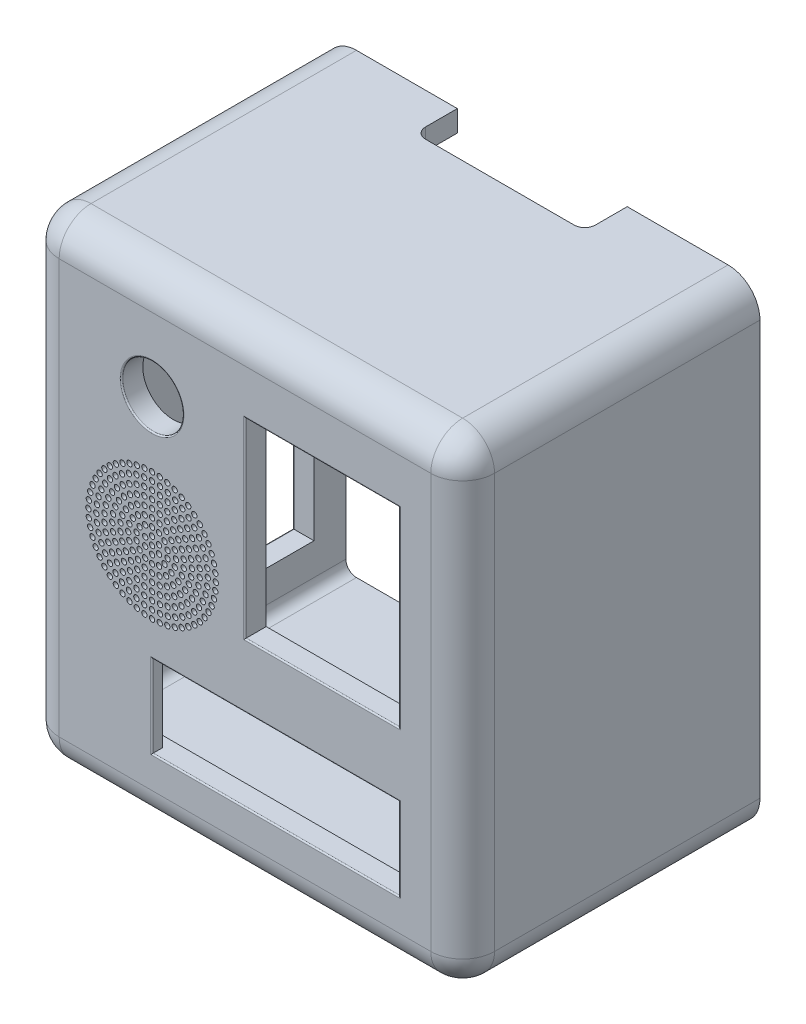
from build123d import *

# Parameters (mm, degrees)
SKETCH1_W               = 130.175
SKETCH1_H               = 142.875
BOSS_EXTRUDE1_DEPTH     = 88.9
FILLET1_R               = 9.525
SHELL2_T                = -6.35
SKETCH3_W               = 33.3375
SKETCH3_H               = 69.05625
CUT_EXTRUDE1_DEPTH      = 6.35
SKETCH4_R               = 9.128125
SKETCH4_R_2             = 19.84375
SKETCH4_W               = 46.0375
SKETCH4_H               = 57.15
SKETCH4_W_2             = 73.81875
SKETCH4_H_2             = 24.60625
CUT_EXTRUDE2_DEPTH      = 6.35
SKETCH5_W               = 50.8
SKETCH5_H               = 12.7
CUT_EXTRUDE3_DEPTH      = 6.35
FILLET2_R               = 3.175
SKETCH6_W               = 3.175
SKETCH6_H               = 24.60625
CUT_EXTRUDE4_DEPTH      = 3.175
SKETCH12_R              = 19.84375
BOSS_EXTRUDE4_DEPTH     = 3.175
FILL_START              = -3.175
FILL_PATTERN1_OUTLINE_R = 0.79375
FILL_PATTERN1_DEPTH     = 3.175
CUT_EXTRUDE5_DEPTH      = 169.342380378
FILLET3_R               = 0.396875
BOSS_EXTRUDE2_DEPTH     = 6.35


# Read off the part's stored shape, not the designer's step: Fill Pattern1
with BuildPart() as part:
    # Sketch1 → Boss-Extrude1 (new body)
    with BuildSketch(Plane.XY):
        Rectangle(SKETCH1_W, SKETCH1_H)
    extrude(amount=-BOSS_EXTRUDE1_DEPTH)

    # Fillet1
    fillet1_edges = [part.edges().sort_by_distance(p)[0] for p in [
        (0, -71.4375, 0),
        (65.0875, 0, 0),
        (0, 71.4375, 0),
        (-65.0875, 0, 0),
        (-65.0875, -71.4375, -44.45),
        (65.0875, -71.4375, -44.45),
        (65.0875, 71.4375, -44.45),
        (-65.0875, 71.4375, -44.45),
    ]]
    fillet(fillet1_edges, radius=FILLET1_R)

    # Shell2
    shell2_openings = [part.faces().sort_by_distance(p)[0] for p in [
        (0, 0, -88.9),
    ]]
    offset(amount=SHELL2_T, openings=shell2_openings, kind=Kind.INTERSECTION)

    # Sketch3 → Cut-Extrude1 (cut)
    with BuildSketch(Plane.ZY.offset(65.0875)):
        with Locations((-62.70625, -17.859375)):
            Rectangle(SKETCH3_W, SKETCH3_H)
    extrude(amount=-CUT_EXTRUDE1_DEPTH, mode=Mode.SUBTRACT)

    # Sketch4 → Cut-Extrude2 (cut)
    with BuildSketch(Plane.XY):
        with Locations((-27.78125, 40.084375)):
            Circle(SKETCH4_R)
        with Locations((-27.78125, 1.5875)):
            Circle(SKETCH4_R_2)
        with Locations((23.01875, 19.84375)):
            Rectangle(SKETCH4_W, SKETCH4_H)
        with Locations((9.128125, -40.084375)):
            Rectangle(SKETCH4_W_2, SKETCH4_H_2)
    extrude(amount=-CUT_EXTRUDE2_DEPTH, mode=Mode.SUBTRACT)

    # Sketch5 → Cut-Extrude3 (cut)
    with BuildSketch(Plane(origin=(0, 71.4375, 0), x_dir=(1, 0, 0), z_dir=(0, 1, 0))):
        with Locations((0, 82.55)):
            Rectangle(SKETCH5_W, SKETCH5_H)
    extrude(amount=-CUT_EXTRUDE3_DEPTH, mode=Mode.SUBTRACT)

    # Fillet2
    fillet2_edges = [part.edges().sort_by_distance(p)[0] for p in [
        (25.4, 68.2625, -76.2),
        (-25.4, 68.2625, -76.2),
    ]]
    fillet(fillet2_edges, radius=FILLET2_R)

    # Sketch6 → Cut-Extrude4 (cut)
    with BuildSketch(Plane(origin=(0, 0, -6.35), x_dir=(-1, 0, 0), z_dir=(0, 0, -1))):
        with Locations((-47.625, -40.084375)):
            Rectangle(SKETCH6_W, SKETCH6_H)
        with Locations((29.36875, -40.084375)):
            Rectangle(SKETCH6_W, SKETCH6_H)
    extrude(amount=-CUT_EXTRUDE4_DEPTH, mode=Mode.SUBTRACT)

    # Sketch12 → Boss-Extrude4 (add)
    with BuildSketch(Plane.XY):
        with Locations((-27.78125, 1.5875)):
            Circle(SKETCH12_R)
    extrude(amount=-BOSS_EXTRUDE4_DEPTH)

    # Fill Pattern1 outline → Fill Pattern1 (cut)
    with BuildSketch(Plane.XY.offset(FILL_START)):
        with Locations((-27.78125, 1.5875)):
            Circle(FILL_PATTERN1_OUTLINE_R)
        with Locations((-20.856801002, -13.574928323)):
            Circle(FILL_PATTERN1_OUTLINE_R)
        with Locations((-30.077473759, -17.323604052)):
            Circle(FILL_PATTERN1_OUTLINE_R)
        with Locations((-16.781309316, 6.143824617)):
            Circle(FILL_PATTERN1_OUTLINE_R)
        with Locations((-14.697138595, -4.15172338)):
            Circle(FILL_PATTERN1_OUTLINE_R)
        with Locations((-18.769443374, -12.435144825)):
            Circle(FILL_PATTERN1_OUTLINE_R)
        with Locations((-27.78125, -17.4625)):
            Circle(FILL_PATTERN1_OUTLINE_R)
        with Locations((-17.881564929, 8.202258087)):
            Circle(FILL_PATTERN1_OUTLINE_R)
        with Locations((-13.9309437, -1.919873898)):
            Circle(FILL_PATTERN1_OUTLINE_R)
        with Locations((-23.354761786, 10.021468644)):
            Circle(FILL_PATTERN1_OUTLINE_R)
        with Locations((-15.875, 1.5875)):
            Circle(FILL_PATTERN1_OUTLINE_R)
        with Locations((-17.269594626, -8.089160455)):
            Circle(FILL_PATTERN1_OUTLINE_R)
        with Locations((-23.085120443, -14.406048504)):
            Circle(FILL_PATTERN1_OUTLINE_R)
        with Locations((-32.340213405, -16.908941622)):
            Circle(FILL_PATTERN1_OUTLINE_R)
        with Locations((-25.501768298, 10.835720811)):
            Circle(FILL_PATTERN1_OUTLINE_R)
        with Locations((-16.103775255, 3.910294147)):
            Circle(FILL_PATTERN1_OUTLINE_R)
        with Locations((-15.820233942, -6.227021809)):
            Circle(FILL_PATTERN1_OUTLINE_R)
        with Locations((-13.758605175, -7.424306626)):
            Circle(FILL_PATTERN1_OUTLINE_R)
        with Locations((-21.026026902, -16.224559423)):
            Circle(FILL_PATTERN1_OUTLINE_R)
        with Locations((-23.224925383, 12.587440684)):
            Circle(FILL_PATTERN1_OUTLINE_R)
        with Locations((-13.9309437, 5.094873898)):
            Circle(FILL_PATTERN1_OUTLINE_R)
        with Locations((-12.618821677, -5.336948998)):
            Circle(FILL_PATTERN1_OUTLINE_R)
        with Locations((-18.928273573, -15.280437289)):
            Circle(FILL_PATTERN1_OUTLINE_R)
        with Locations((-25.458455853, 13.264974745)):
            Circle(FILL_PATTERN1_OUTLINE_R)
        with Locations((-14.697138595, 7.32672338)):
            Circle(FILL_PATTERN1_OUTLINE_R)
        with Locations((-16.865540141, -11.009900718)):
            Circle(FILL_PATTERN1_OUTLINE_R)
        with Locations((-25.485026241, -17.323604052)):
            Circle(FILL_PATTERN1_OUTLINE_R)
        with Locations((-19.362259886, 10.006490114)):
            Circle(FILL_PATTERN1_OUTLINE_R)
        with Locations((-13.542549056, 0.407647602)):
            Circle(FILL_PATTERN1_OUTLINE_R)
        with Locations((-15.183849282, -9.328209859)):
            Circle(FILL_PATTERN1_OUTLINE_R)
        with Locations((-23.222286595, -16.908941622)):
            Circle(FILL_PATTERN1_OUTLINE_R)
        with Locations((-21.166491913, 11.487185071)):
            Circle(FILL_PATTERN1_OUTLINE_R)
        with Locations((-13.542549056, 2.767352398)):
            Circle(FILL_PATTERN1_OUTLINE_R)
        with Locations((-21.166491913, -8.312185071)):
            Circle(FILL_PATTERN1_OUTLINE_R)
        with Locations((-27.78125, -12.7)):
            Circle(FILL_PATTERN1_OUTLINE_R)
        with Locations((-34.705698998, -13.574928323)):
            Circle(FILL_PATTERN1_OUTLINE_R)
        with Locations((-42.040379753, -11.044986639)):
            Circle(FILL_PATTERN1_OUTLINE_R)
        with Locations((-18.325697974, 2.735611879)):
            Circle(FILL_PATTERN1_OUTLINE_R)
        with Locations((-19.362259886, -6.831490114)):
            Circle(FILL_PATTERN1_OUTLINE_R)
        with Locations((-25.429604791, -12.505137122)):
            Circle(FILL_PATTERN1_OUTLINE_R)
        with Locations((-32.477379557, -14.406048504)):
            Circle(FILL_PATTERN1_OUTLINE_R)
        with Locations((-23.582259104, 7.366915154)):
            Circle(FILL_PATTERN1_OUTLINE_R)
        with Locations((-18.875220288, -1.790111549)):
            Circle(FILL_PATTERN1_OUTLINE_R)
        with Locations((-23.224925383, -9.412440684)):
            Circle(FILL_PATTERN1_OUTLINE_R)
        with Locations((-30.132895209, -12.505137122)):
            Circle(FILL_PATTERN1_OUTLINE_R)
        with Locations((-36.793056626, -12.435144825)):
            Circle(FILL_PATTERN1_OUTLINE_R)
        with Locations((-43.459092645, -9.234133425)):
            Circle(FILL_PATTERN1_OUTLINE_R)
        with Locations((-25.573709846, 8.381609988)):
            Circle(FILL_PATTERN1_OUTLINE_R)
        with Locations((-18.325697974, 0.439388121)):
            Circle(FILL_PATTERN1_OUTLINE_R)
        with Locations((-21.46500668, 8.717064876)):
            Circle(FILL_PATTERN1_OUTLINE_R)
        with Locations((-36.634226427, -15.280437289)):
            Circle(FILL_PATTERN1_OUTLINE_R)
        with Locations((-27.78125, -15.08125)):
            Circle(FILL_PATTERN1_OUTLINE_R)
        with Locations((-20.981151622, -10.97798122)):
            Circle(FILL_PATTERN1_OUTLINE_R)
        with Locations((-16.103775255, -0.735294147)):
            Circle(FILL_PATTERN1_OUTLINE_R)
        with Locations((-19.005685867, -9.687345028)):
            Circle(FILL_PATTERN1_OUTLINE_R)
        with Locations((-25.40903954, -14.911586159)):
            Circle(FILL_PATTERN1_OUTLINE_R)
        with Locations((-34.536473098, -16.224559423)):
            Circle(FILL_PATTERN1_OUTLINE_R)
        with Locations((-23.142106334, -11.925863841)):
            Circle(FILL_PATTERN1_OUTLINE_R)
        with Locations((-17.881564929, -5.027258087)):
            Circle(FILL_PATTERN1_OUTLINE_R)
        with Locations((-18.875220288, 4.965111549)):
            Circle(FILL_PATTERN1_OUTLINE_R)
        with Locations((-40.413736639, -12.671629753)):
            Circle(FILL_PATTERN1_OUTLINE_R)
        with Locations((-30.15346046, -14.911586159)):
            Circle(FILL_PATTERN1_OUTLINE_R)
        with Locations((-38.602883425, -14.090342645)):
            Circle(FILL_PATTERN1_OUTLINE_R)
        with Locations((-19.942328677, 6.998316713)):
            Circle(FILL_PATTERN1_OUTLINE_R)
        with Locations((-16.781309316, -2.968824617)):
            Circle(FILL_PATTERN1_OUTLINE_R)
        with Locations((-25.485026241, 20.498604052)):
            Circle(FILL_PATTERN1_OUTLINE_R)
        with Locations((-23.222286595, 20.083941622)):
            Circle(FILL_PATTERN1_OUTLINE_R)
        with Locations((-21.026026902, 19.399559423)):
            Circle(FILL_PATTERN1_OUTLINE_R)
        with Locations((-18.928273573, 18.455437289)):
            Circle(FILL_PATTERN1_OUTLINE_R)
        with Locations((-16.959616575, 17.265342645)):
            Circle(FILL_PATTERN1_OUTLINE_R)
        with Locations((-15.148763361, 15.846629753)):
            Circle(FILL_PATTERN1_OUTLINE_R)
        with Locations((-13.522120247, 14.219986639)):
            Circle(FILL_PATTERN1_OUTLINE_R)
        with Locations((-12.103407355, 12.409133425)):
            Circle(FILL_PATTERN1_OUTLINE_R)
        with Locations((-20.981151622, 14.15298122)):
            Circle(FILL_PATTERN1_OUTLINE_R)
        with Locations((-12.103407355, -9.234133425)):
            Circle(FILL_PATTERN1_OUTLINE_R)
        with Locations((-11.282163841, 3.95971046)):
            Circle(FILL_PATTERN1_OUTLINE_R)
        with Locations((-19.005685867, 12.862345028)):
            Circle(FILL_PATTERN1_OUTLINE_R)
        with Locations((-11.787701496, 6.283629557)):
            Circle(FILL_PATTERN1_OUTLINE_R)
        with Locations((-10.913312711, -7.265476427)):
            Circle(FILL_PATTERN1_OUTLINE_R)
        with Locations((-23.142106334, 15.100863841)):
            Circle(FILL_PATTERN1_OUTLINE_R)
        with Locations((-12.618821677, 8.511948998)):
            Circle(FILL_PATTERN1_OUTLINE_R)
        with Locations((-11.787701496, -3.108629557)):
            Circle(FILL_PATTERN1_OUTLINE_R)
        with Locations((-16.959616575, -14.090342645)):
            Circle(FILL_PATTERN1_OUTLINE_R)
        with Locations((-15.820233942, 9.402021809)):
            Circle(FILL_PATTERN1_OUTLINE_R)
        with Locations((-11.282163841, -0.78471046)):
            Circle(FILL_PATTERN1_OUTLINE_R)
        with Locations((-15.148763361, -12.671629753)):
            Circle(FILL_PATTERN1_OUTLINE_R)
        with Locations((-17.269594626, 11.264160455)):
            Circle(FILL_PATTERN1_OUTLINE_R)
        with Locations((-11.1125, 1.5875)):
            Circle(FILL_PATTERN1_OUTLINE_R)
        with Locations((-13.522120247, -11.044986639)):
            Circle(FILL_PATTERN1_OUTLINE_R)
        with Locations((-9.284808378, 6.146463405)):
            Circle(FILL_PATTERN1_OUTLINE_R)
        with Locations((-20.856801002, 16.749928323)):
            Circle(FILL_PATTERN1_OUTLINE_R)
        with Locations((-8.870145948, 3.883723759)):
            Circle(FILL_PATTERN1_OUTLINE_R)
        with Locations((-18.769443374, 15.610144825)):
            Circle(FILL_PATTERN1_OUTLINE_R)
        with Locations((-10.913312711, 10.440476427)):
            Circle(FILL_PATTERN1_OUTLINE_R)
        with Locations((-25.40903954, 18.086586159)):
            Circle(FILL_PATTERN1_OUTLINE_R)
        with Locations((-9.969190577, 8.342723098)):
            Circle(FILL_PATTERN1_OUTLINE_R)
        with Locations((-23.085120443, 17.581048504)):
            Circle(FILL_PATTERN1_OUTLINE_R)
        with Locations((-9.284808378, -2.971463405)):
            Circle(FILL_PATTERN1_OUTLINE_R)
        with Locations((-13.758605175, 10.599306626)):
            Circle(FILL_PATTERN1_OUTLINE_R)
        with Locations((-25.429604791, 15.680137122)):
            Circle(FILL_PATTERN1_OUTLINE_R)
        with Locations((-9.969190577, -5.167723098)):
            Circle(FILL_PATTERN1_OUTLINE_R)
        with Locations((-8.73125, 1.5875)):
            Circle(FILL_PATTERN1_OUTLINE_R)
        with Locations((-16.865540141, 14.184900718)):
            Circle(FILL_PATTERN1_OUTLINE_R)
        with Locations((-8.870145948, -0.708723759)):
            Circle(FILL_PATTERN1_OUTLINE_R)
        with Locations((-15.183849282, 12.503209859)):
            Circle(FILL_PATTERN1_OUTLINE_R)
        with Locations((-38.602883425, 17.265342645)):
            Circle(FILL_PATTERN1_OUTLINE_R)
        with Locations((-38.696959859, 14.184900718)):
            Circle(FILL_PATTERN1_OUTLINE_R)
        with Locations((-38.292905374, 11.264160455)):
            Circle(FILL_PATTERN1_OUTLINE_R)
        with Locations((-37.680935071, 8.202258087)):
            Circle(FILL_PATTERN1_OUTLINE_R)
        with Locations((-36.687279712, 4.965111549)):
            Circle(FILL_PATTERN1_OUTLINE_R)
        with Locations((-34.925, 1.5875)):
            Circle(FILL_PATTERN1_OUTLINE_R)
        with Locations((-31.504722435, -1.381870181)):
            Circle(FILL_PATTERN1_OUTLINE_R)
        with Locations((-25.719027007, 2.778125)):
            Circle(FILL_PATTERN1_OUTLINE_R)
        with Locations((-36.634226427, 18.455437289)):
            Circle(FILL_PATTERN1_OUTLINE_R)
        with Locations((-36.793056626, 15.610144825)):
            Circle(FILL_PATTERN1_OUTLINE_R)
        with Locations((-36.556814133, 12.862345028)):
            Circle(FILL_PATTERN1_OUTLINE_R)
        with Locations((-36.200240114, 10.006490114)):
            Circle(FILL_PATTERN1_OUTLINE_R)
        with Locations((-35.620171323, 6.998316713)):
            Circle(FILL_PATTERN1_OUTLINE_R)
        with Locations((-34.575359988, 3.795040154)):
            Circle(FILL_PATTERN1_OUTLINE_R)
        with Locations((-32.424344182, 0.527744052)):
            Circle(FILL_PATTERN1_OUTLINE_R)
        with Locations((-25.719027007, 0.396875)):
            Circle(FILL_PATTERN1_OUTLINE_R)
        with Locations((-33.560665154, -2.611490896)):
            Circle(FILL_PATTERN1_OUTLINE_R)
        with Locations((-37.236802026, 0.439388121)):
            Circle(FILL_PATTERN1_OUTLINE_R)
        with Locations((-39.458724745, 3.910294147)):
            Circle(FILL_PATTERN1_OUTLINE_R)
        with Locations((-40.865361405, 7.32672338)):
            Circle(FILL_PATTERN1_OUTLINE_R)
        with Locations((-41.803894825, 10.599306626)):
            Circle(FILL_PATTERN1_OUTLINE_R)
        with Locations((-42.040379753, 14.219986639)):
            Circle(FILL_PATTERN1_OUTLINE_R)
        with Locations((-25.714878692, -2.703364233)):
            Circle(FILL_PATTERN1_OUTLINE_R)
        with Locations((-31.980240896, -4.191915154)):
            Circle(FILL_PATTERN1_OUTLINE_R)
        with Locations((-29.847621308, -2.703364233)):
            Circle(FILL_PATTERN1_OUTLINE_R)
        with Locations((-34.575359988, -0.620040154)):
            Circle(FILL_PATTERN1_OUTLINE_R)
        with Locations((-37.236802026, 2.735611879)):
            Circle(FILL_PATTERN1_OUTLINE_R)
        with Locations((-38.781190684, 6.143824617)):
            Circle(FILL_PATTERN1_OUTLINE_R)
        with Locations((-27.78125, -3.175)):
            Circle(FILL_PATTERN1_OUTLINE_R)
        with Locations((-40.413736639, 15.846629753)):
            Circle(FILL_PATTERN1_OUTLINE_R)
        with Locations((-40.378650718, 12.503209859)):
            Circle(FILL_PATTERN1_OUTLINE_R)
        with Locations((-39.742266058, 9.402021809)):
            Circle(FILL_PATTERN1_OUTLINE_R)
        with Locations((-27.78125, 3.96875)):
            Circle(FILL_PATTERN1_OUTLINE_R)
        with Locations((-27.78125, 6.35)):
            Circle(FILL_PATTERN1_OUTLINE_R)
        with Locations((-27.78125, 8.73125)):
            Circle(FILL_PATTERN1_OUTLINE_R)
        with Locations((-27.78125, 11.1125)):
            Circle(FILL_PATTERN1_OUTLINE_R)
        with Locations((-27.78125, 13.49375)):
            Circle(FILL_PATTERN1_OUTLINE_R)
        with Locations((-27.78125, 15.875)):
            Circle(FILL_PATTERN1_OUTLINE_R)
        with Locations((-27.78125, 18.25625)):
            Circle(FILL_PATTERN1_OUTLINE_R)
        with Locations((-27.78125, 20.6375)):
            Circle(FILL_PATTERN1_OUTLINE_R)
        with Locations((-29.843472993, 2.778125)):
            Circle(FILL_PATTERN1_OUTLINE_R)
        with Locations((-29.847621308, 5.878364233)):
            Circle(FILL_PATTERN1_OUTLINE_R)
        with Locations((-29.988790154, 8.381609988)):
            Circle(FILL_PATTERN1_OUTLINE_R)
        with Locations((-30.060731702, 10.835720811)):
            Circle(FILL_PATTERN1_OUTLINE_R)
        with Locations((-30.104044147, 13.264974745)):
            Circle(FILL_PATTERN1_OUTLINE_R)
        with Locations((-30.132895209, 15.680137122)):
            Circle(FILL_PATTERN1_OUTLINE_R)
        with Locations((-30.15346046, 18.086586159)):
            Circle(FILL_PATTERN1_OUTLINE_R)
        with Locations((-30.077473759, 20.498604052)):
            Circle(FILL_PATTERN1_OUTLINE_R)
        with Locations((-34.536473098, 19.399559423)):
            Circle(FILL_PATTERN1_OUTLINE_R)
        with Locations((-34.705698998, 16.749928323)):
            Circle(FILL_PATTERN1_OUTLINE_R)
        with Locations((-34.581348378, 14.15298122)):
            Circle(FILL_PATTERN1_OUTLINE_R)
        with Locations((-34.396008087, 11.487185071)):
            Circle(FILL_PATTERN1_OUTLINE_R)
        with Locations((-34.09749332, 8.717064876)):
            Circle(FILL_PATTERN1_OUTLINE_R)
        with Locations((-33.560665154, 5.786490896)):
            Circle(FILL_PATTERN1_OUTLINE_R)
        with Locations((-32.424344182, 2.647255948)):
            Circle(FILL_PATTERN1_OUTLINE_R)
        with Locations((-27.78125, -0.79375)):
            Circle(FILL_PATTERN1_OUTLINE_R)
        with Locations((-32.340213405, 20.083941622)):
            Circle(FILL_PATTERN1_OUTLINE_R)
        with Locations((-32.477379557, 17.581048504)):
            Circle(FILL_PATTERN1_OUTLINE_R)
        with Locations((-32.420393666, 15.100863841)):
            Circle(FILL_PATTERN1_OUTLINE_R)
        with Locations((-32.337574617, 12.587440684)):
            Circle(FILL_PATTERN1_OUTLINE_R)
        with Locations((-32.207738214, 10.021468644)):
            Circle(FILL_PATTERN1_OUTLINE_R)
        with Locations((-31.980240896, 7.366915154)):
            Circle(FILL_PATTERN1_OUTLINE_R)
        with Locations((-31.504722435, 4.556870181)):
            Circle(FILL_PATTERN1_OUTLINE_R)
        with Locations((-29.843472993, 0.396875)):
            Circle(FILL_PATTERN1_OUTLINE_R)
        with Locations((-20.987140012, -0.620040154)):
            Circle(FILL_PATTERN1_OUTLINE_R)
        with Locations((-25.501768298, -7.660720811)):
            Circle(FILL_PATTERN1_OUTLINE_R)
        with Locations((-32.337574617, -9.412440684)):
            Circle(FILL_PATTERN1_OUTLINE_R)
        with Locations((-38.292905374, -8.089160455)):
            Circle(FILL_PATTERN1_OUTLINE_R)
        with Locations((-42.943678323, -5.336948998)):
            Circle(FILL_PATTERN1_OUTLINE_R)
        with Locations((-46.692354052, -0.708723759)):
            Circle(FILL_PATTERN1_OUTLINE_R)
        with Locations((-20.6375, 1.5875)):
            Circle(FILL_PATTERN1_OUTLINE_R)
        with Locations((-23.354761786, -6.846468644)):
            Circle(FILL_PATTERN1_OUTLINE_R)
        with Locations((-46.692354052, 3.883723759)):
            Circle(FILL_PATTERN1_OUTLINE_R)
        with Locations((-25.714878692, 5.878364233)):
            Circle(FILL_PATTERN1_OUTLINE_R)
        with Locations((-22.001834846, -2.611490896)):
            Circle(FILL_PATTERN1_OUTLINE_R)
        with Locations((-27.78125, -7.9375)):
            Circle(FILL_PATTERN1_OUTLINE_R)
        with Locations((-34.396008087, -8.312185071)):
            Circle(FILL_PATTERN1_OUTLINE_R)
        with Locations((-39.742266058, -6.227021809)):
            Circle(FILL_PATTERN1_OUTLINE_R)
        with Locations((-43.774798504, -3.108629557)):
            Circle(FILL_PATTERN1_OUTLINE_R)
        with Locations((-46.83125, 1.5875)):
            Circle(FILL_PATTERN1_OUTLINE_R)
        with Locations((-40.378650718, -9.328209859)):
            Circle(FILL_PATTERN1_OUTLINE_R)
        with Locations((-45.593309423, -5.167723098)):
            Circle(FILL_PATTERN1_OUTLINE_R)
        with Locations((-22.001834846, 5.786490896)):
            Circle(FILL_PATTERN1_OUTLINE_R)
        with Locations((-19.942328677, -3.823316713)):
            Circle(FILL_PATTERN1_OUTLINE_R)
        with Locations((-25.458455853, -10.089974745)):
            Circle(FILL_PATTERN1_OUTLINE_R)
        with Locations((-32.420393666, -11.925863841)):
            Circle(FILL_PATTERN1_OUTLINE_R)
        with Locations((-38.696959859, -11.009900718)):
            Circle(FILL_PATTERN1_OUTLINE_R)
        with Locations((-44.649187289, -7.265476427)):
            Circle(FILL_PATTERN1_OUTLINE_R)
        with Locations((-30.104044147, -10.089974745)):
            Circle(FILL_PATTERN1_OUTLINE_R)
        with Locations((-36.556814133, -9.687345028)):
            Circle(FILL_PATTERN1_OUTLINE_R)
        with Locations((-41.803894825, -7.424306626)):
            Circle(FILL_PATTERN1_OUTLINE_R)
        with Locations((-46.277691622, -2.971463405)):
            Circle(FILL_PATTERN1_OUTLINE_R)
        with Locations((-20.987140012, 3.795040154)):
            Circle(FILL_PATTERN1_OUTLINE_R)
        with Locations((-21.46500668, -5.542064876)):
            Circle(FILL_PATTERN1_OUTLINE_R)
        with Locations((-27.78125, -10.31875)):
            Circle(FILL_PATTERN1_OUTLINE_R)
        with Locations((-34.581348378, -10.97798122)):
            Circle(FILL_PATTERN1_OUTLINE_R)
        with Locations((-39.458724745, -0.735294147)):
            Circle(FILL_PATTERN1_OUTLINE_R)
        with Locations((-42.019950944, 2.767352398)):
            Circle(FILL_PATTERN1_OUTLINE_R)
        with Locations((-43.774798504, 6.283629557)):
            Circle(FILL_PATTERN1_OUTLINE_R)
        with Locations((-44.649187289, 10.440476427)):
            Circle(FILL_PATTERN1_OUTLINE_R)
        with Locations((-23.138155818, 0.527744052)):
            Circle(FILL_PATTERN1_OUTLINE_R)
        with Locations((-27.78125, -5.55625)):
            Circle(FILL_PATTERN1_OUTLINE_R)
        with Locations((-34.09749332, -5.542064876)):
            Circle(FILL_PATTERN1_OUTLINE_R)
        with Locations((-38.781190684, -2.968824617)):
            Circle(FILL_PATTERN1_OUTLINE_R)
        with Locations((-36.687279712, -1.790111549)):
            Circle(FILL_PATTERN1_OUTLINE_R)
        with Locations((-39.6875, 1.5875)):
            Circle(FILL_PATTERN1_OUTLINE_R)
        with Locations((-41.6315563, 5.094873898)):
            Circle(FILL_PATTERN1_OUTLINE_R)
        with Locations((-42.943678323, 8.511948998)):
            Circle(FILL_PATTERN1_OUTLINE_R)
        with Locations((-43.459092645, 12.409133425)):
            Circle(FILL_PATTERN1_OUTLINE_R)
        with Locations((-24.057777565, -1.381870181)):
            Circle(FILL_PATTERN1_OUTLINE_R)
        with Locations((-29.988790154, -5.206609988)):
            Circle(FILL_PATTERN1_OUTLINE_R)
        with Locations((-35.620171323, -3.823316713)):
            Circle(FILL_PATTERN1_OUTLINE_R)
        with Locations((-44.45, 1.5875)):
            Circle(FILL_PATTERN1_OUTLINE_R)
        with Locations((-46.277691622, 6.146463405)):
            Circle(FILL_PATTERN1_OUTLINE_R)
        with Locations((-24.057777565, 4.556870181)):
            Circle(FILL_PATTERN1_OUTLINE_R)
        with Locations((-23.582259104, -4.191915154)):
            Circle(FILL_PATTERN1_OUTLINE_R)
        with Locations((-30.060731702, -7.660720811)):
            Circle(FILL_PATTERN1_OUTLINE_R)
        with Locations((-36.200240114, -6.831490114)):
            Circle(FILL_PATTERN1_OUTLINE_R)
        with Locations((-40.865361405, -4.15172338)):
            Circle(FILL_PATTERN1_OUTLINE_R)
        with Locations((-44.280336159, -0.78471046)):
            Circle(FILL_PATTERN1_OUTLINE_R)
        with Locations((-41.6315563, -1.919873898)):
            Circle(FILL_PATTERN1_OUTLINE_R)
        with Locations((-37.680935071, -5.027258087)):
            Circle(FILL_PATTERN1_OUTLINE_R)
        with Locations((-32.207738214, -6.846468644)):
            Circle(FILL_PATTERN1_OUTLINE_R)
        with Locations((-25.573709846, -5.206609988)):
            Circle(FILL_PATTERN1_OUTLINE_R)
        with Locations((-42.019950944, 0.407647602)):
            Circle(FILL_PATTERN1_OUTLINE_R)
        with Locations((-44.280336159, 3.95971046)):
            Circle(FILL_PATTERN1_OUTLINE_R)
        with Locations((-45.593309423, 8.342723098)):
            Circle(FILL_PATTERN1_OUTLINE_R)
        with Locations((-23.138155818, 2.647255948)):
            Circle(FILL_PATTERN1_OUTLINE_R)
    extrude(amount=FILL_PATTERN1_DEPTH, mode=Mode.SUBTRACT)

    # Sketch15 → Cut-Extrude5 (cut, through all)
    with BuildSketch(Plane(origin=(-58.7375, 0, 0), x_dir=(0, 0, -1), z_dir=(1, 0, 0))):
        with BuildLine():
            Line((55.5625, 16.66875), (46.0375, 16.66875))
            ThreePointArc((46.0375, 16.66875), (50.8, 21.43125), (55.5625, 16.66875))
        make_face()
    extrude(amount=-CUT_EXTRUDE5_DEPTH, mode=Mode.SUBTRACT)

    # Fillet3
    fillet3_edges = [part.edges().sort_by_distance(p)[0] for p in [
        (-27.78125, -40.084375, 0),
        (9.128125, -52.3875, 0),
        (46.0375, -40.084375, 0),
        (9.128125, -27.78125, 0),
        (0, 19.84375, 0),
        (23.01875, -8.73125, 0),
        (46.0375, 19.84375, 0),
        (23.01875, 48.41875, 0),
        (-36.909375, 40.084375, 0),
        (-65.0875, 21.43125, -50.8),
        (-65.0875, -17.859375, -79.375),
        (-65.0875, -52.3875, -62.70625),
        (-65.0875, -17.859375, -46.0375),
        (-65.0875, 16.66875, -67.46875),
    ]]
    fillet(fillet3_edges, radius=FILLET3_R)

    # Sketch7 → Boss-Extrude2 (add)
    with BuildSketch(Plane(origin=(0, 0, -82.55), x_dir=(-1, 0, 0), z_dir=(0, 0, -1))):
        Polygon((42.8625, 65.0875), (49.2125, 65.0875), (49.2125, 55.5625), (58.7375, 55.5625), (58.7375, 49.2125), (42.8625, 49.2125), align=None)
        Polygon((-42.8625, -65.0875), (-49.2125, -65.0875), (-49.2125, -55.5625), (-58.7375, -55.5625), (-58.7375, -49.2125), (-42.8625, -49.2125), align=None)
    extrude(amount=-BOSS_EXTRUDE2_DEPTH)


solid = part.part
